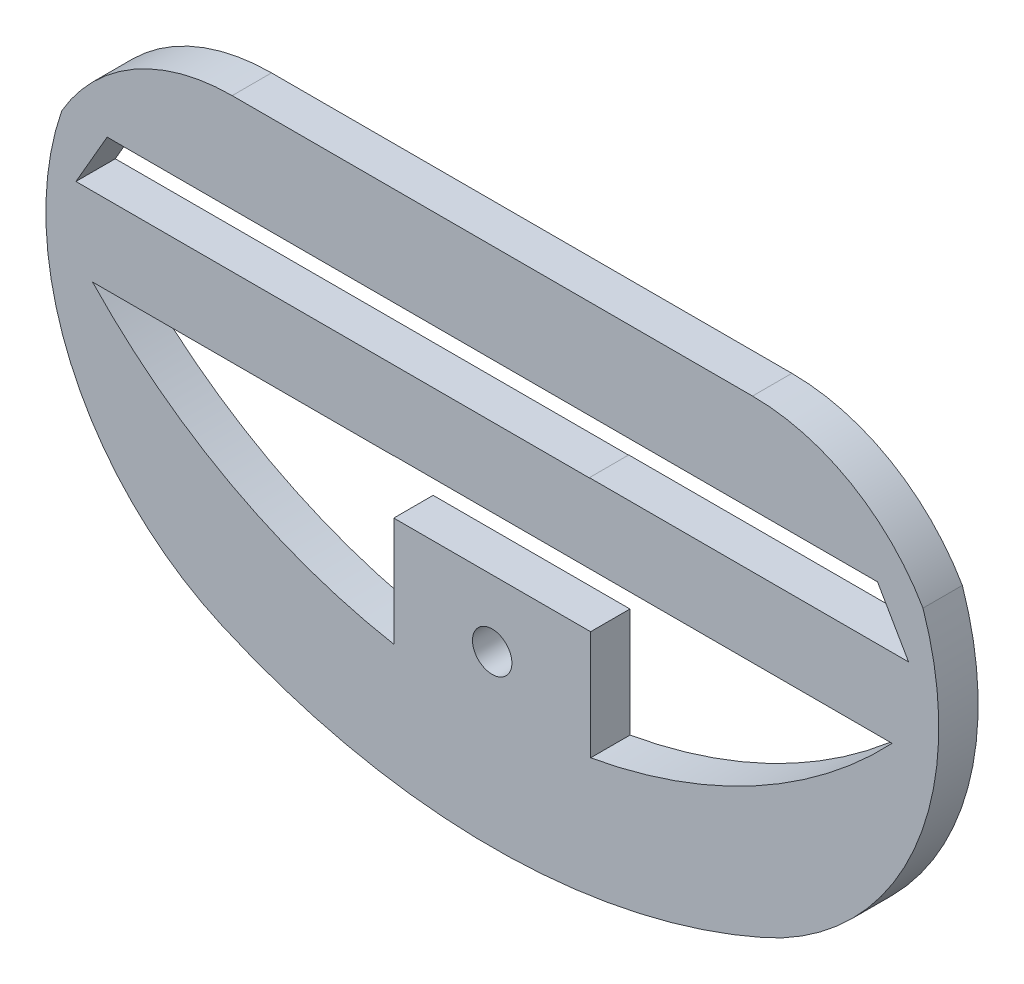
from build123d import *

# Parameters (mm, degrees)
SKETCH1_R           = 0.9999999999999973
BOSS_EXTRUDE1_DEPTH = 2
BOSS_EXTRUDE2_DEPTH = 2
BOSS_EXTRUDE3_DEPTH = 2
BOSS_EXTRUDE4_DEPTH = 2
BOSS_EXTRUDE6_DEPTH = 2
CUT_EXTRUDE5_DEPTH  = 10
CUT_EXTRUDE6_DEPTH  = 10
FILLET3_R           = 10
FILLET4_R           = 15


with BuildPart() as part:
    # Sketch1 → Boss-Extrude1 (new body)
    with BuildSketch(Plane.XY):
        with BuildLine():
            Line((-25.026699742262835, -12.489403509000002), (-31.579999999831756, -12.489403509000002))
            ThreePointArc((-31.579999999831788, -12.489403509000118), (-4.3876e-13, -33.96), (31.579999999831465, -12.489403509000935))
            Line((31.579999999831173, -12.489403509000002), (25.026699742262835, -12.489403509000002))
            ThreePointArc((25.026699742262835, -12.489403508999999), (16.78917371704707, -22.3706179149977), (5.000000000000879, -27.51946402094327))
            Line((5.000000000000001, -27.519464020943122), (5.000000000000001, -21.97))
            Line((5.000000000000001, -21.97), (0, -21.97))
            Line((0, -21.97), (-5.000000000000001, -21.970000000000002))
            Line((-5.000000000000001, -21.970000000000002), (-5.000000000000001, -27.519464020943126))
            ThreePointArc((-5.000000000000872, -27.519464020943275), (-16.789173717047063, -22.370617914997695), (-25.02669974226283, -12.489403508999999))
        make_face()
        with Locations((2.25e-15, -25.35)):
            Circle(SKETCH1_R, mode=Mode.SUBTRACT)
    extrude(amount=BOSS_EXTRUDE1_DEPTH)

    # Sketch2 → Boss-Extrude2 (add)
    with BuildSketch(Plane.XY.offset(2)):
        with BuildLine():
            Line((-31.57999999983184, -12.489403509000002), (-25.026699742262828, -12.489403509000002))
            Line((-25.026699742262828, -12.489403509000002), (0, -12.489403509000002))
            Line((0, -12.489403509000002), (25.026699742262828, -12.489403509000002))
            Line((25.026699742262828, -12.489403509000002), (31.57999999983184, -12.489403509000002))
            ThreePointArc((31.57999999983184, -12.489403509000002), (30.972585231224635, -9.734010611787788), (29.262941504232284, -7.489403509000002))
            Line((29.262941504232288, -7.489403509000003), (-29.262941504232284, -7.489403509000003))
            ThreePointArc((-29.262941504232284, -7.489403509000002), (-30.972585231224635, -9.734010611787788), (-31.57999999983184, -12.489403509000002))
        make_face()
    extrude(amount=-BOSS_EXTRUDE2_DEPTH)

    # Sketch3 → Boss-Extrude3 (add)
    with BuildSketch(Plane.XY.offset(2)):
        Polygon((-24.813781653352383, -19.23578932070869), (-5, -19.235789320708687), (-5.000000000000001, -19.223614188291315), (25.52831463289919, -19.223614188291315), (25.52831463289919, -15.223614188291313), (4.937516262759692, -15.223614188291313), (4.937516262759691, -15.235789320708687), (-24.813781653352386, -15.235789320708694), align=None)
    extrude(amount=-BOSS_EXTRUDE3_DEPTH)

    # Sketch4 → Boss-Extrude4 (add)
    with BuildSketch(Plane.XY):
        Polygon((26.752232503098107, -20.918882764148314), (23.464067657719866, -15.223614188291315), (21.15466658096137, -15.223614188291313), (25.020181695529228, -21.918882764148307), align=None)
        Polygon((21.15466658096137, -15.223614188291313), (23.464067657719863, -15.223614188291313), (18.99871904006177, -7.489403509000002), (17.266668232492894, -8.489403508999997), align=None)
    extrude(amount=BOSS_EXTRUDE4_DEPTH)

    # Sketch6 → Boss-Extrude6 (add)
    with BuildSketch(Plane(origin=(0, 0, 0), x_dir=(-1, 0, 0), z_dir=(0, 0, -1))):
        Polygon((21.146762799182063, -15.235789320708694), (23.45616387594056, -15.235789320708694), (22.962540836382626, -14.38080913640776), (21.870537288251985, -12.489403509), (19.561136211493483, -12.489403509000002), align=None)
    extrude(amount=-BOSS_EXTRUDE6_DEPTH)

    # Sketch7 → Cut-Extrude5 (cut)
    with BuildSketch(Plane(origin=(0, 0, 0), x_dir=(-1, 0, 0), z_dir=(0, 0, -1))):
        with BuildLine():
            Line((23.456163875940437, -15.235789320708776), (26.743640561861312, -20.92986596942182))
            ThreePointArc((26.743640561861444, -20.929865969421787), (29.465608999795766, -16.88370475550775), (31.579999999831838, -12.489403509000006))
            ThreePointArc((31.579999999831834, -12.489403508999994), (30.972585231224627, -9.734010611787786), (29.262941504232284, -7.489403509000004))
            Line((29.262941504232284, -7.489403509000003), (18.983785942303626, -7.489403509000003))
            Line((18.98378594230363, -7.4894035090000095), (21.87053728825184, -12.489403509000091))
            Line((21.87053728825199, -12.489403509000002), (25.026699742262828, -12.489403509000002))
            ThreePointArc((25.02669974226283, -12.489403509000006), (24.280293962635962, -13.884819951586834), (23.456163875940568, -15.235789320708696))
        make_face()
    extrude(amount=-CUT_EXTRUDE5_DEPTH, mode=Mode.SUBTRACT)

    # Sketch8 → Cut-Extrude6 (cut)
    with BuildSketch(Plane(origin=(0, 0, 0), x_dir=(-1, 0, 0), z_dir=(0, 0, -1))):
        with BuildLine():
            Line((-26.752232503097716, -20.918882764147654), (-23.464067657719863, -15.223614188291315))
            ThreePointArc((-23.46406765771987, -15.223614188291315), (-24.283896058283027, -13.878519093567089), (-25.026699742262828, -12.489403509000002))
            Line((-25.026699742262828, -12.489403509000002), (-21.88547038600989, -12.489403509000002))
            Line((-21.88547038600989, -12.489403509000002), (-18.998719040061772, -7.4894035090000015))
            Line((-18.998719040061772, -7.489403509000003), (-29.262941504232288, -7.489403509000003))
            ThreePointArc((-29.262941504232284, -7.489403509000002), (-30.97258523122463, -9.73401061178779), (-31.57999999983184, -12.489403509000002))
            ThreePointArc((-31.57999999983184, -12.489403509000002), (-29.469074761896252, -16.877654833470505), (-26.75223250309883, -20.9188827641474))
        make_face()
    extrude(amount=-CUT_EXTRUDE6_DEPTH, mode=Mode.SUBTRACT)

    # Fillet3
    fillet3_edges = [part.edges().sort_by_distance(p)[0] for p in [
        (-18.983785942303626, -7.489403509000006, 1),
        (18.998719040061772, -7.489403509000002, 1),
    ]]
    fillet(fillet3_edges, radius=FILLET3_R)

    # Fillet4
    # the kernel refuses this fillet: 15 mm, written as the material it takes off along each edge
    with BuildSketch(Plane(origin=(26.752232503098277, -20.91888276414753, -41.15536178864485), x_dir=(-0.5000000000000459, 0.8660254037844121, 0), z_dir=(0, 0, 1))) as fillet4_piece_1:
        with BuildLine():
            CenterArc((12.63895144979885, 14.71592649800607), FILLET4_R, 173.92282911126543, 84.90866305824733)
            ThreePointArc((-2.2767516311276927, 16.30394463443854), (-2.1412465863768713, 8.011927210685023), (0, 0))
            Line((0, 0), (9.73352423417586, 7.4e-16))
        make_face()
    extrude(amount=84.3107235772897, mode=Mode.SUBTRACT)
    with BuildSketch(Plane(origin=(-26.743640561861376, -20.929865969421805, -41.183176669180206), x_dir=(0.7889080559016987, -0.6145112524058467, 0), z_dir=(0, 0, 1))) as fillet4_piece_2:
        with BuildLine():
            CenterArc((12.835180855907009, 14.552123643012767), FILLET4_R, 199.06172243650428, 84.97473929921648)
            Line((-1.342328727646797, 9.653325626331542), (0, 0))
            ThreePointArc((0, 0), (8.236635333836043, -1.0139920722190925), (16.473270667672082, 5.9e-16))
        make_face()
    extrude(amount=84.36635333836041, mode=Mode.SUBTRACT)


solid = part.part
